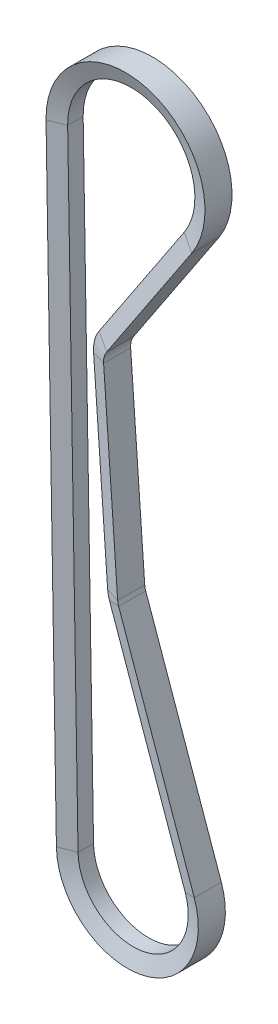
from build123d import *


with BuildPart() as part:
    # Sweep1: sweep along a path in Sketch2
    with BuildLine(Plane.XY) as sweep1_path:
        Line((-24.996550203, -0.415304675), (-28.650891534, 219.533884433))
        ThreePointArc((-28.650891534, 219.533884433), (7.212605136, 246.871030426), (22.670035865, 204.50857323))
        Line((22.670035865, 204.50857323), (-7.322883388, 159.346652946))
        ThreePointArc((-7.322883388, 159.346652946), (-8.173460755, 157.452013029), (-8.367233193, 155.384261953))
        Line((-8.367233193, 155.384261953), (-3.413463574, 85.55976649))
        ThreePointArc((-3.413463574, 85.55976649), (-3.296583432, 84.717271304), (-3.068155412, 83.89795467))
        Line((-3.068155412, 83.89795467), (23.577838857, 8.311769657))
        ThreePointArc((23.577838857, 8.311769657), (4.420819163, -24.606022798), (-24.996550203, -0.415304675))
    # Sketch3 → Sweep1 (sweep)
    with BuildSketch(Plane(origin=(23.577838857, 8.311769657, 0), x_dir=(-0.9431135542837219, -0.3324707862750126, 0), z_dir=(0.3324707862750126, -0.9431135542837219, 0))):
        Polygon((0, -4.7625), (0, 4.7625), (5.588, 2.728634331), (5.588, -2.728634331), align=None)
    sweep(path=sweep1_path.line)


solid = part.part
